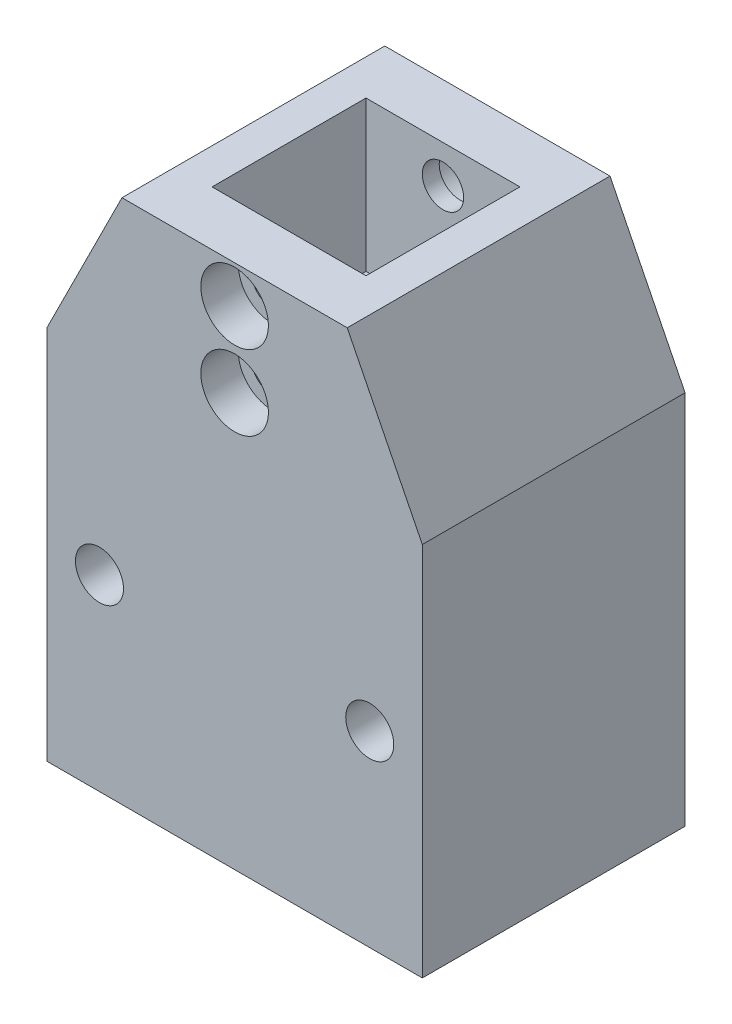
from build123d import *

# Parameters (mm, degrees)
BODY_DEPTH            = 17.5
SKETCH4_W             = 20.5
SKETCH4_H             = 20.5
PROFIL_HOLE_DEPTH     = 20
M5_CLEARANCE_HOLE1_D  = 5.5
SKETCH14_R            = 7.5
BEARING_SUPPORT_DEPTH = 4
SKETCH15_R            = 7.5
SKETCH15_R_2          = 4.7
BEARING_PLACE_DEPTH   = 4
SKETCH16_R            = 2
SHAFT_PLACE_DEPTH     = 3
SKETCH17_R            = 3.2
INSERTS_HOLES_DEPTH   = 9.5
FILLET1_R             = 6
SKETCH19_R            = 4.5
M5_SCREW_PLACE_DEPTH  = 5


with BuildPart() as part:
    # Sketch1 → Body (new, symmetric)
    with BuildSketch(Plane.XY):
        Polygon((-25, 25), (-15, 45), (15, 45), (25, 25), (25, -25), (-25, -25), align=None)
    extrude(amount=BODY_DEPTH, both=True)

    # Sketch4 → Profil_Hole (cut)
    with BuildSketch(Plane(origin=(0, 45, 0), x_dir=(1, 0, 0), z_dir=(0, 1, 0))):
        Rectangle(SKETCH4_W, SKETCH4_H)
    extrude(amount=-PROFIL_HOLE_DEPTH, mode=Mode.SUBTRACT)

    # M5 Clearance Hole1 (through all)
    with Locations(Plane(origin=(0, 0, -17.5), x_dir=(-1, 0, 0), z_dir=(0, 0, -1))):
        with Locations((0, 40), (0, 30)):
            Hole(M5_CLEARANCE_HOLE1_D / 2)

    # Sketch14 → Bearing_Support (add)
    with BuildSketch(Plane(origin=(0, 0, -17.5), x_dir=(-1, 0, 0), z_dir=(0, 0, -1))):
        Circle(SKETCH14_R)
    extrude(amount=BEARING_SUPPORT_DEPTH)

    # Sketch15 → Bearing_Place (add)
    with BuildSketch(Plane(origin=(0, 0, -21.5), x_dir=(-1, 0, 0), z_dir=(0, 0, -1))):
        Circle(SKETCH15_R)
        Circle(SKETCH15_R_2, mode=Mode.SUBTRACT)
    extrude(amount=BEARING_PLACE_DEPTH)

    # Sketch16 → Shaft_Place (cut)
    with BuildSketch(Plane(origin=(0, 0, -21.5), x_dir=(-1, 0, 0), z_dir=(0, 0, -1))):
        Circle(SKETCH16_R)
    extrude(amount=-SHAFT_PLACE_DEPTH, mode=Mode.SUBTRACT)

    # Sketch17 → Inserts_Holes (cut)
    with BuildSketch(Plane.XY.offset(17.5)):
        with Locations((-18, 0)):
            Circle(SKETCH17_R)
        with Locations((18, 0)):
            Circle(SKETCH17_R)
    extrude(amount=-INSERTS_HOLES_DEPTH, mode=Mode.SUBTRACT)

    # Fillet1
    fillet1_edges = [part.edges().sort_by_distance(p)[0] for p in [
        (7.5, 0, -17.5),
    ]]
    fillet(fillet1_edges, radius=FILLET1_R)

    # Sketch19 → M5_Screw_Place (cut)
    with BuildSketch(Plane(origin=(0, 0, -17.5), x_dir=(-1, 0, 0), z_dir=(0, 0, -1))):
        with Locations((0, 40)):
            Circle(SKETCH19_R)
        with Locations((0, 30)):
            Circle(SKETCH19_R)
    m5_screw_place = extrude(amount=-M5_SCREW_PLACE_DEPTH, mode=Mode.SUBTRACT)

    # Mirror1: M5_Screw_Place across plane
    add(m5_screw_place.mirror(Plane.XY), mode=Mode.SUBTRACT)


solid = part.part
